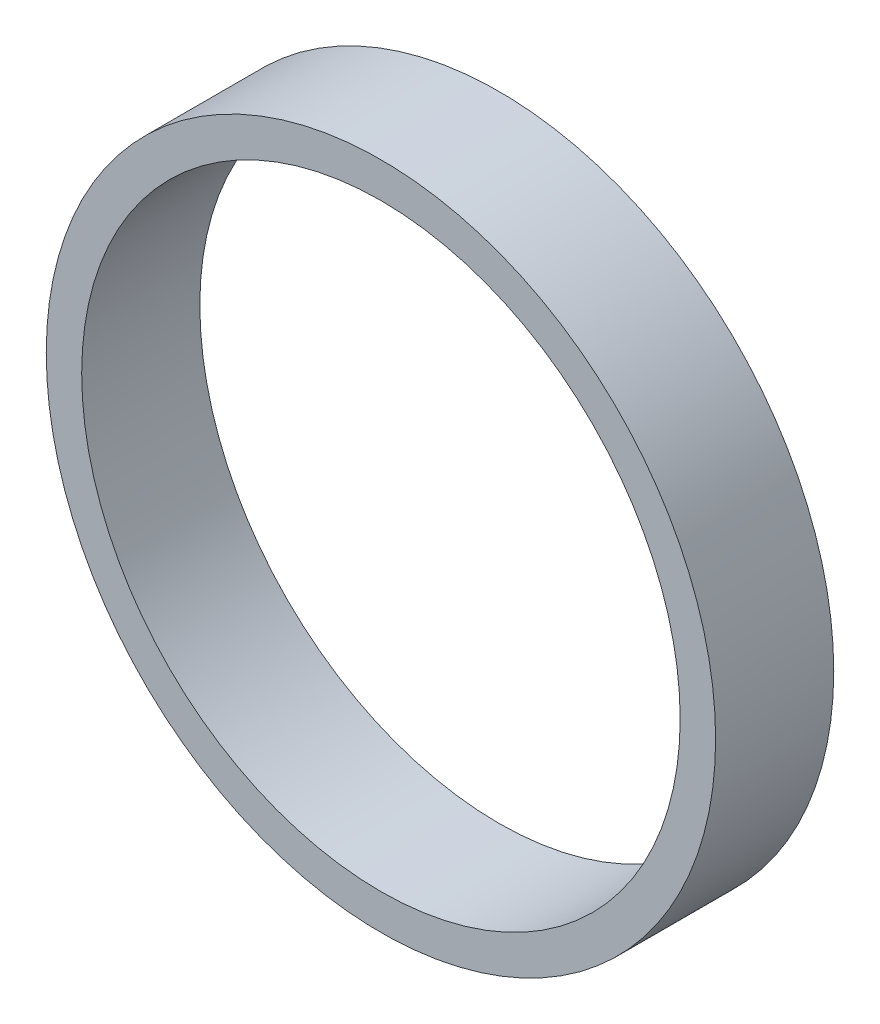
from build123d import *

# Parameters (mm, degrees)
SKETCH1_R           = 53.975
BOSS_EXTRUDE1_DEPTH = 19.05
SKETCH2_R           = 48.26
CUT_EXTRUDE1_DEPTH  = 79.673399253


with BuildPart() as part:
    # Sketch1 → Boss-Extrude1 (new body)
    with BuildSketch(Plane.XY):
        Circle(SKETCH1_R)
    extrude(amount=BOSS_EXTRUDE1_DEPTH)

    # Sketch2 → Cut-Extrude1 (cut, through all)
    with BuildSketch(Plane.XY.offset(19.05)):
        Circle(SKETCH2_R)
    extrude(amount=-CUT_EXTRUDE1_DEPTH, mode=Mode.SUBTRACT)


solid = part.part
